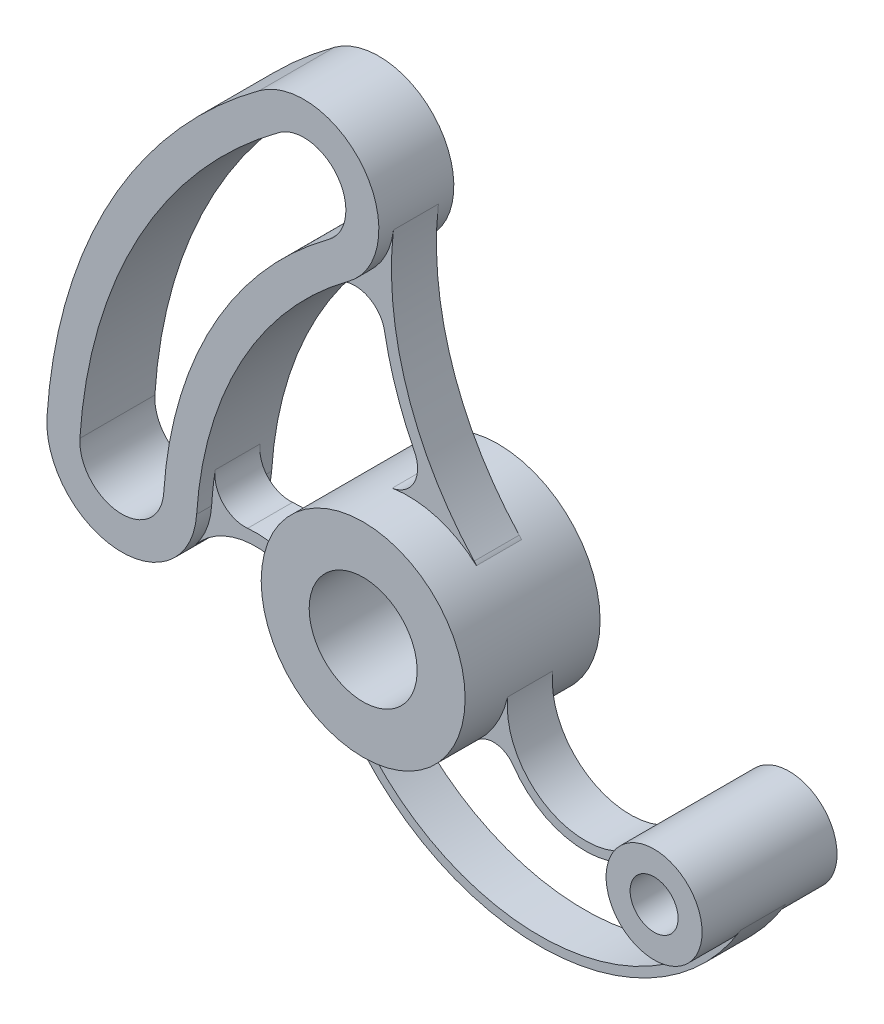
from build123d import *

# Parameters (mm, degrees)
SKETCH1_R            = 34
SKETCH1_R_2          = 18
BOSS_EXTRUDE1_DEPTH  = 22.5
SKETCH2_R            = 16
SKETCH2_R_2          = 8
BOSS_EXTRUDE2_DEPTH  = 22.5
BOSS_EXTRUDE4_DEPTH  = 7.5
BOSS_EXTRUDE5_DEPTH  = 7.5
BOSS_EXTRUDE13_DEPTH = 12.5
BOSS_EXTRUDE14_DEPTH = 7.5
FILLET14_R           = 10
FILLET16_R           = 8
FILLET17_R           = 8


with BuildPart() as part:
    # Sketch1 → Boss-Extrude1 (new, symmetric)
    with BuildSketch(Plane.XY):
        with Locations(Location((0, 0, 0), (0, 0, 180))):
            Circle(SKETCH1_R)
        with Locations(Location((0, 0, 0), (0, 0, 180))):
            Circle(SKETCH1_R_2, mode=Mode.SUBTRACT)
    extrude(amount=BOSS_EXTRUDE1_DEPTH, both=True)



with BuildPart() as body_2:
    # Sketch2 → Boss-Extrude2 (new, symmetric)
    with BuildSketch(Plane.XY):
        with Locations(Location((97, -28, 0), (0, 0, 180))):
            Circle(SKETCH2_R)
        with Locations(Location((97, -28, 0), (0, 0, 180))):
            Circle(SKETCH2_R_2, mode=Mode.SUBTRACT)
    extrude(amount=BOSS_EXTRUDE2_DEPTH, both=True)


with BuildPart() as part_1:
    add(part.part)

    add(body_2.part)  # Boss-Extrude4 merges body 2
    # Sketch4 → Boss-Extrude4 (add, symmetric)
    with BuildSketch(Plane.XY):
        with BuildLine():
            ThreePointArc((33.206005609, -7.1003724), (51.777283235, -34.98924979), (82.412015856, -21.417404229))
            ThreePointArc((82.412015856, -21.417404229), (81.371091146, -25.082275632), (81.074017469, -28.880505994))
            ThreePointArc((81.074017469, -28.880505994), (51.369473654, -37.991410417), (30.470988374, -14.999633287))
            ThreePointArc((30.470988374, -14.999633287), (32.120493939, -11.147640651), (33.206005609, -7.1003724))
        make_face()
    extrude(amount=BOSS_EXTRUDE4_DEPTH, both=True)

    # Sketch5 → Boss-Extrude5 (add, symmetric)
    with BuildSketch(Plane.XY):
        with BuildLine():
            ThreePointArc((-34.031526001, -0.792277944), (25.431977893, -71.913257024), (110.881269035, -35.961614448))
            ThreePointArc((110.881269035, -35.961614448), (107.27285681, -40.164612784), (102.451649001, -42.892577053))
            ThreePointArc((102.451649001, -42.892577053), (30.885190637, -69.988396494), (-27.207046107, -20.176415768))
            ThreePointArc((-27.207046107, -20.176415768), (-31.977671369, -10.96258702), (-34.031526001, -0.792277944))
        make_face()
    extrude(amount=BOSS_EXTRUDE5_DEPTH, both=True)



with BuildPart() as body_2_2:
    # Sketch8 → Boss-Extrude13 (new, symmetric)
    with BuildSketch(Plane.XY):
        with BuildLine():
            ThreePointArc((-14.937494573, 90.972331385), (-50.475974734, 50.279724458), (-65.522765853, -1.609252288))
            ThreePointArc((-65.522765853, -1.609252288), (-92.080170519, -24.948152378), (-115.419070609, 1.609252288))
            ThreePointArc((-115.419070609, 1.609252288), (-94.353563042, 74.253819732), (-44.599690817, 131.223469431))
            ThreePointArc((-44.599690817, 131.223469431), (-9.643023672, 125.92899853), (-14.937494573, 90.972331385))
        make_face()
        with BuildLine():
            ThreePointArc((-104.441883562, 0.901181281), (-91.372099512, -13.970965332), (-76.499952899, -0.901181281))
            ThreePointArc((-76.499952899, -0.901181281), (-60.129044162, 55.554025418), (-21.463177747, 99.827581755))
            ThreePointArc((-21.463177747, 99.827581755), (-18.498274042, 119.403315356), (-38.074007643, 122.368219061))
            ThreePointArc((-38.074007643, 122.368219061), (-84.700493614, 68.979518772), (-104.441883562, 0.901181281))
        make_face(mode=Mode.SUBTRACT)
    extrude(amount=BOSS_EXTRUDE13_DEPTH, both=True)


with BuildPart() as part_2:
    add(part_1.part)

    add(body_2_2.part)  # Boss-Extrude14 merges body 2 2
    # Sketch8<9> → Boss-Extrude14 (add, symmetric)
    with BuildSketch(Plane.XY):
        with BuildLine():
            ThreePointArc((-4.924235101, 108.312600467), (-0.101365505, 63.440523319), (23.275646022, 24.836395161))
            ThreePointArc((23.275646022, 24.836395161), (18.02581673, 28.582349539), (12.304584847, 31.558989848))
            ThreePointArc((12.304584847, 31.558989848), (-3.899104901, 62.184418871), (-9.571104645, 96.364894046))
            ThreePointArc((-9.571104645, 96.364894046), (-6.468831174, 102.035830387), (-4.924235101, 108.312600467))
        make_face()
        with BuildLine():
            ThreePointArc((-31.919461404, -14.075384629), (-51.826123505, -6.018423189), (-71.003100626, -15.684517133))
            ThreePointArc((-71.003100626, -15.684517133), (-68.148351126, -11.256242618), (-66.285052548, -6.32802506))
            ThreePointArc((-66.285052548, -6.32802506), (-49.617118255, -2.018061944), (-33.32443821, -7.580830374))
            ThreePointArc((-33.32443821, -7.580830374), (-32.713889809, -10.847997022), (-31.919461404, -14.075384629))
        make_face()
    extrude(amount=BOSS_EXTRUDE14_DEPTH, both=True)

    # Fillet14
    # the kernel refuses this fillet: 10 mm, written as the material it adds along each edge
    with BuildSketch(Plane(origin=(-9.571104645, 96.364894046, -7.5), x_dir=(-0.7492882116327264, -0.6622440455815594, 0), z_dir=(0, 0, 1))) as fillet14_piece_1:
        with BuildLine():
            CenterArc((19.69565471, 9.999601125), FILLET14_R, 148.729139323, 121.782610057)
            Line((11.148425358, 15.19044599), (10.293702423, 15.709530477))
            ThreePointArc((10.293702423, 15.709530477), (5.099940987, 7.943295893), (-0.751496774, 0.659736764))
            Line((-0.751496774, 0.659736764), (0.215075759, -0.976597367))
            ThreePointArc((0.215075759, -0.976597367), (7.503554375, -0.509342466), (19.793902231, -0.999960113))
            Line((19.793902231, -0.999960113), (19.784970638, 0))
        make_face()
    extrude(amount=15)
    with BuildSketch(Plane(origin=(12.159345053, 31.751383086, -7.5), x_dir=(-0.5285784325634836, 0.8488844683634699, 0), z_dir=(0, 0, 1))) as fillet14_piece_2:
        with BuildLine():
            CenterArc((19.996455315, 9.960779633), FILLET14_R, 157.06784833, 107.855989322)
            ThreePointArc((10.786786288, 13.857187776), (6.303465021, 6.220170866), (0, 0))
            ThreePointArc((0, 0), (9.555828204, 0.423579966), (19.111656407, 0))
        make_face()
    extrude(amount=15)
    with BuildSketch(Plane(origin=(-32.126211784, -13.860546046, -7.5), x_dir=(-0.7488822965541873, 0.6627030299521243, 0), z_dir=(0, 0, 1))) as fillet14_piece_3:
        with BuildLine():
            CenterArc((3.122942969, 9.972317771), FILLET14_R, 236.75546449, 37.508743658)
            ThreePointArc((-2.359191707, 1.608933325), (-1.172232304, 0.815263894), (0, 0))
            ThreePointArc((0, 0), (1.933250409, -0.071973796), (3.866500819, 0))
        make_face()
    extrude(amount=15)
    with BuildSketch(Plane(origin=(-33.32443821, -7.580830374, -7.5), x_dir=(-0.9057047717229613, 0.42390903089962434, 0), z_dir=(0, 0, 1))) as fillet14_piece_4:
        with BuildLine():
            CenterArc((12.689549677, -9.834316561), FILLET14_R, 100.444283177, 56.0673219)
            ThreePointArc((3.518141468, -5.84868343), (1.823073957, -2.885842043), (0, 0))
            ThreePointArc((0, 0), (5.438378433, -0.497050317), (10.876756866, 0))
        make_face()
    extrude(amount=15)
    with BuildSketch(Plane(origin=(-66.285052548, -6.32802506, -7.5), x_dir=(0.12382892083322194, 0.9923035817557446, 0), z_dir=(0, 0, 1))) as fillet14_piece_5:
        with BuildLine():
            CenterArc((15.518466833, -9.995933117), FILLET14_R, 88.36588285, 104.037213694)
            Line((5.751860117, -12.143814227), (4.775199446, -12.358602338))
            ThreePointArc((4.775199446, -12.358602338), (2.660832169, -6.173787211), (-0.784932001, -0.619581919))
            Line((-0.784932001, -0.619581919), (0.131376491, 0.991332546))
            ThreePointArc((0.131376491, 0.991332546), (4.717150823, 0.82611724), (15.832152273, 0.999593312))
            Line((15.832152273, 0.999593312), (15.803635414, 0))
        make_face()
    extrude(amount=15)
    # the kernel refuses this fillet: 10 mm, written as the material it takes off along each edge
    with BuildSketch(Plane(origin=(23.275646022, 24.836395161, 12.075662987), x_dir=(-0.775723763432973, 0.6310726129736459, 0), z_dir=(0, 0, -1))) as fillet14_2_piece_1:
        with BuildLine():
            CenterArc((3.231710715, -9.655465783), FILLET14_R, 98.150393055, 6.933334265)
            ThreePointArc((1.813991439, 0.243527704), (0.907531451, 0.117773287), (0, 0))
            ThreePointArc((0, 0), (0.314703895, 0.001074211), (0.62940779, 0))
        make_face()
    extrude(amount=24.151325973, mode=Mode.SUBTRACT)

    # Fillet16
    fillet16_edges = [part_2.edges().sort_by_distance(p)[0] for p in [
        (102.283564786, -43.10244825, 0),
        (-27.073199852, -20.567981178, 0),
    ]]
    fillet(fillet16_edges, radius=FILLET16_R)

    # Fillet17
    fillet17_edges = [part_2.edges().sort_by_distance(p)[0] for p in [
        (30.481870475, -15.06172541, 0),
        (81.027337873, -28.934914209, 0),
    ]]
    fillet(fillet17_edges, radius=FILLET17_R)


solid = part_2.part
